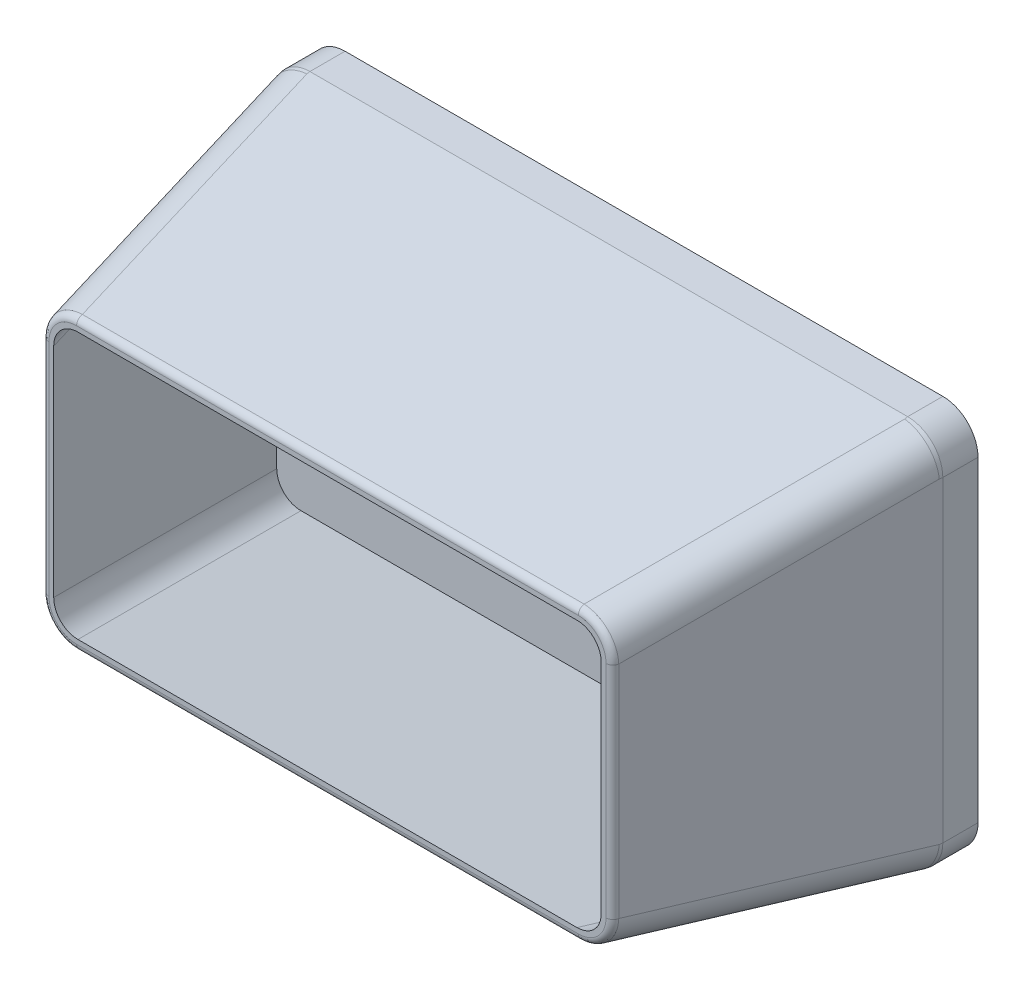
from build123d import *

# Parameters (mm, degrees)
BOSS_EXTRUDE1_DEPTH = 7.5
BOSS_EXTRUDE2_DEPTH = 60
BOSS_EXTRUDE2_TAPER = 10
FILLET1_R           = 7.5
SHELL1_T            = -2.25
FILLET2_R           = 1.5


with BuildPart() as part:
    # Sketch1 → Boss-Extrude1 (new body)
    with BuildSketch(Plane.XY):
        with BuildLine():
            Line((63.75, 41.25), (-63.75, 41.25))
            ThreePointArc((-63.75, 41.25), (-69.053300859, 39.053300859), (-71.25, 33.75))
            Line((-71.25, 33.75), (-71.25, -33.75))
            ThreePointArc((-71.25, -33.75), (-69.053300859, -39.053300859), (-63.75, -41.25))
            Line((-63.75, -41.25), (63.75, -41.25))
            ThreePointArc((63.75, -41.25), (69.053300859, -39.053300859), (71.25, -33.75))
            Line((71.25, -33.75), (71.25, 33.75))
            ThreePointArc((71.25, 33.75), (69.053300859, 39.053300859), (63.75, 41.25))
        make_face()
    extrude(amount=BOSS_EXTRUDE1_DEPTH)


with BuildPart() as body_2:
    # Sketch2 → Boss-Extrude2 (new body)
    with BuildSketch(Plane.XY.offset(7.5)):
        with BuildLine():
            Line((63.75, 41.25), (-63.75, 41.25))
            ThreePointArc((-63.75, 41.25), (-69.053300859, 39.053300859), (-71.25, 33.75))
            Line((-71.25, 33.75), (-71.25, -33.75))
            ThreePointArc((-71.25, -33.75), (-69.053300859, -39.053300859), (-63.75, -41.25))
            Line((-63.75, -41.25), (63.75, -41.25))
            ThreePointArc((63.75, -41.25), (69.053300859, -39.053300859), (71.25, -33.75))
            Line((71.25, -33.75), (71.25, 33.75))
            ThreePointArc((71.25, 33.75), (69.053300859, 39.053300859), (63.75, 41.25))
        make_face()
    extrude(amount=BOSS_EXTRUDE2_DEPTH, taper=BOSS_EXTRUDE2_TAPER)

    # Fillet1
    # the kernel refuses this fillet: 7.5 mm, written as the material it takes off along each edge
    with BuildSketch(Plane(origin=(71.220200572, -41.220200572, 7.669000952), x_dir=(0.029709096802316395, 0.9852557743173919, -0.16848866057223885), z_dir=(-0.17108786974603593, 0.17108786974603585, 0.9702875252478139)), Plane(origin=(-71.220200572, -41.220200572, 7.669000952), x_dir=(0.9852557743173919, -0.029709096802316395, -0.1684886605722389), z_dir=(0.17108786974603588, 0.17108786974603593, 0.9702875252478139)), Plane(origin=(71.220200572, 41.220200572, 7.669000952), x_dir=(-0.9852557743173919, 0.02970909680231639, -0.16848866057223888), z_dir=(-0.17108786974603585, -0.17108786974603593, 0.9702875252478139))) as fillet1_piece_1:
        with BuildLine():
            CenterArc((FILLET1_R * 0.970287525248, FILLET1_R), FILLET1_R, 181.727941072, 88.272058928)
            Line((-FILLET1_R * 0.0292577488659, FILLET1_R * 0.969846310393), (-FILLET1_R * 0.0492486543482, FILLET1_R * 0.969243236601))
            Line((-FILLET1_R * 0.0492486543482, FILLET1_R * 0.969243236601), (-FILLET1_R * 0.019405750505, -FILLET1_R * 0.02))
            Line((-FILLET1_R * 0.019405750505, -FILLET1_R * 0.02), (FILLET1_R * 0.970287525248, -FILLET1_R * 0.02))
            Line((FILLET1_R * 0.970287525248, -FILLET1_R * 0.02), (FILLET1_R * 0.970287525248, 0))
        make_face()
    extrude(amount=105.326102895, mode=Mode.SUBTRACT)
    with BuildSketch(Plane(origin=(-71.220200572, 41.220200572, 7.669000952), x_dir=(0.9852557743173919, 0.02970909680231644, -0.1684886605722389), z_dir=(0.1710878697460359, -0.17108786974603588, 0.9702875252478139))) as fillet1_piece_2:
        with BuildLine():
            CenterArc((FILLET1_R * 0.970287525248, -FILLET1_R), FILLET1_R, 90, 88.272058928)
            Line((-FILLET1_R * 0.0292577488659, -FILLET1_R * 0.969846310393), (-FILLET1_R * 0.0492486543482, -FILLET1_R * 0.969243236601))
            Line((-FILLET1_R * 0.0492486543482, -FILLET1_R * 0.969243236601), (-FILLET1_R * 0.019405750505, FILLET1_R * 0.02))
            Line((-FILLET1_R * 0.019405750505, FILLET1_R * 0.02), (FILLET1_R * 0.970287525248, FILLET1_R * 0.02))
            Line((FILLET1_R * 0.970287525248, FILLET1_R * 0.02), (FILLET1_R * 0.970287525248, 0))
        make_face()
    extrude(amount=105.326102895, mode=Mode.SUBTRACT)

    # Shell1
    shell1_openings = [body_2.faces().sort_by_distance(p)[0] for p in [
        (0, 0, 67.5),
    ]]
    offset(amount=SHELL1_T, openings=shell1_openings)

    # Fillet2
    fillet2_edges = [body_2.edges().sort_by_distance(p)[0] for p in [
        (60.670381157, 0, 67.5),
        (0, -30.670381157, 67.5),
        (0, 30.670381157, 67.5),
        (-60.670381157, 0, 67.5),
        (58.520381911, 28.520381911, 67.5),
        (-58.520381911, 28.520381911, 67.5),
        (-58.520381911, -28.520381911, 67.5),
        (58.520381911, -28.520381911, 67.5),
    ]]
    fillet(fillet2_edges, radius=FILLET2_R)


solid = Compound([part.part, body_2.part])
